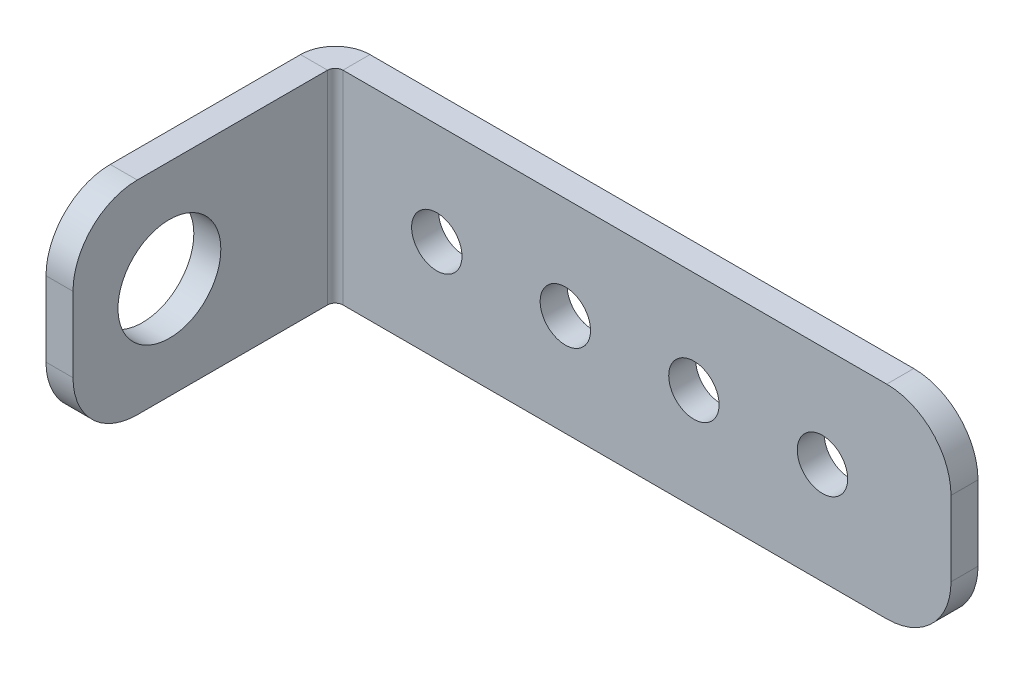
from build123d import *

# Parameters (mm, degrees)
BASE_FLANGE1_DEPTH = 20.0914
SKETCH6_R          = 5.08
CUT_EXTRUDE1_DEPTH = 71.148762412
FILLET1_R          = 6.35
SKETCH7_R          = 2.4892
CUT_EXTRUDE2_DEPTH = 73.473753725


# Sheet-metal steps are written as plain solids
with BuildPart() as part:
    # Sketch1 → Base-Flange1 (new body)
    with BuildSketch(Plane(origin=(0, 0, 0), x_dir=(1, 0, 0), z_dir=(0, 1, 0))):
        with BuildLine():
            Line((0, -28.575), (0, -3.429))
            ThreePointArc((0, -3.429), (1.004330847, -1.004330847), (3.429, 0))
            Line((3.429, 0), (63.5, 0))
            Line((63.5, 0), (63.5, -2.667))
            Line((63.5, -2.667), (3.429, -2.667))
            ThreePointArc((3.429, -2.667), (2.890184633, -2.890184633), (2.667, -3.429))
            Line((2.667, -3.429), (2.667, -28.575))
            Line((2.667, -28.575), (0, -28.575))
        make_face()
    extrude(amount=BASE_FLANGE1_DEPTH)

    # Sketch6 → Cut-Extrude1 (cut, through all)
    with BuildSketch(Plane(origin=(2.667, 0, 0), x_dir=(0, 0, -1), z_dir=(1, 0, 0))):
        with Locations((-19.05, 10.0457)):
            Circle(SKETCH6_R)
    extrude(amount=-CUT_EXTRUDE1_DEPTH, mode=Mode.SUBTRACT)

    # Fillet1
    fillet1_edges = [part.edges().sort_by_distance(p)[0] for p in [
        (1.3335, 20.0914, 28.575),
        (1.3335, 0, 28.575),
        (63.5, 20.0914, 1.3335),
        (63.5, 0, 1.3335),
    ]]
    fillet(fillet1_edges, radius=FILLET1_R)

    # Sketch7 → Cut-Extrude2 (cut, through all)
    with BuildSketch(Plane(origin=(0, 0, 0), x_dir=(-1, 0, 0), z_dir=(0, 0, -1))):
        with Locations((-50.8, 10.0457)):
            Circle(SKETCH7_R)
        with Locations((-38.1, 10.0457)):
            Circle(SKETCH7_R)
        with Locations((-25.4, 10.0457)):
            Circle(SKETCH7_R)
        with Locations((-12.7, 10.0457)):
            Circle(SKETCH7_R)
    extrude(amount=-CUT_EXTRUDE2_DEPTH, mode=Mode.SUBTRACT)


solid = part.part
